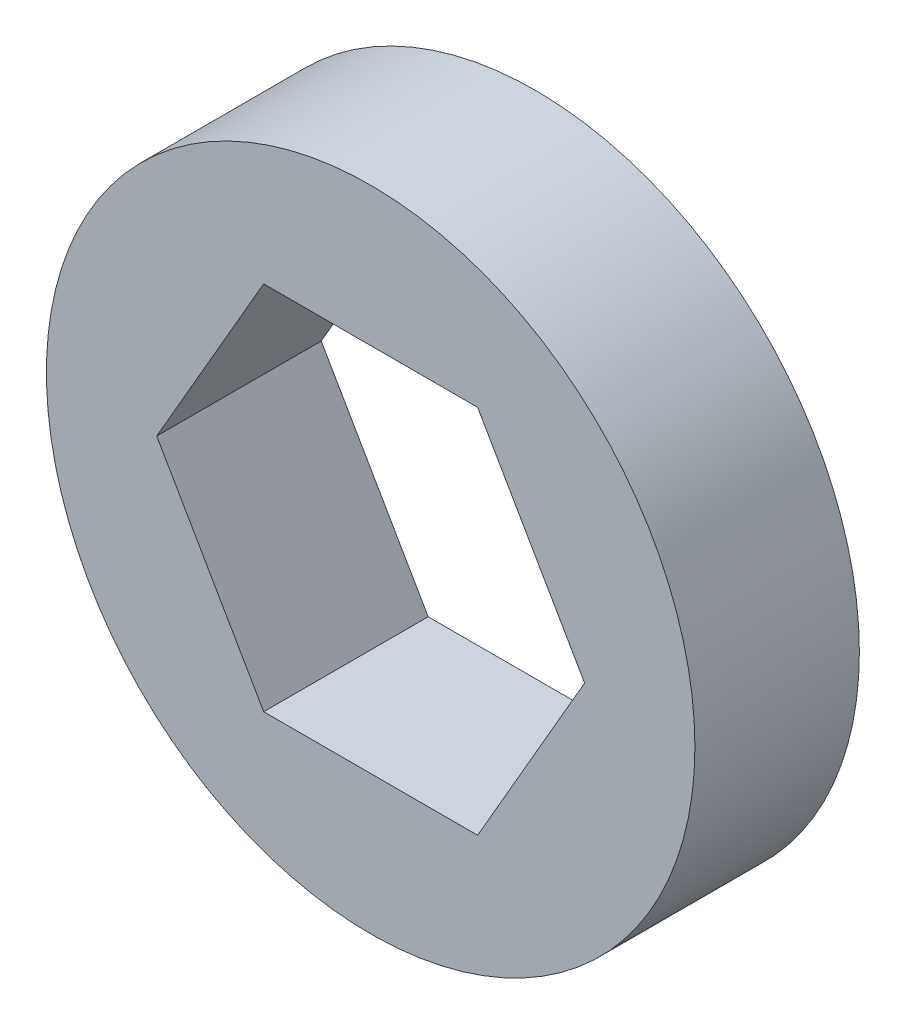
from build123d import *

# Parameters (mm, degrees)
SKETCH1_R           = 11.1125
BOSS_EXTRUDE1_DEPTH = 5.63753
CUT_EXTRUDE1_DEPTH  = 0.4


with BuildPart() as part:
    # Sketch1 → Boss-Extrude1 (new body)
    with BuildSketch(Plane.XY):
        Circle(SKETCH1_R)
        Polygon((3.666174209, 6.35), (-3.666174209, 6.35), (-7.332348419, 0), (-3.666174209, -6.35), (3.666174209, -6.35), (7.332348419, 0), align=None, mode=Mode.SUBTRACT)
    extrude(amount=BOSS_EXTRUDE1_DEPTH)

    # Sketch2 → Cut-Extrude1 (cut)
    # profile 1 of 4: a face of its own
    with BuildSketch(Plane(origin=(0, 0, 0), x_dir=(-1, 0, 0), z_dir=(0, 0, -1))):
        with BuildLine():
            add(Edge.make_bspline(
                [(-2.473143607, 7.778113982), (-2.472994827, 7.803558155), (-2.472705821, 7.852983826), (-2.469490715, 7.925004003), (-2.464149757, 7.992568134), (-2.456830305, 8.055679453), (-2.447923079, 8.114354254), (-2.436032483, 8.168435733), (-2.422510247, 8.218174197), (-2.406838245, 8.263731841), (-2.389154498, 8.305722442), (-2.36990753, 8.344922444), (-2.348333498, 8.381272534), (-2.325665398, 8.415352889), (-2.300985637, 8.446605637), (-2.274996543, 8.47547213), (-2.246683763, 8.50128522), (-2.217009756, 8.524801222), (-2.18570586, 8.545415804), (-2.153664365, 8.56357351), (-2.120664727, 8.579085593), (-2.086616851, 8.591282326), (-2.051826763, 8.601356532), (-2.016172843, 8.608245804), (-1.979596225, 8.612580545), (-1.954907681, 8.612994959), (-1.942386896, 8.613205128)],
                knots=[0, 0, 0, 0, 1.646270934, 3.197905019, 4.663502075, 6.030701355, 7.308322542, 8.50163776, 9.611534131, 10.641858119, 11.616356847, 12.558055219, 13.465016945, 14.349605745, 15.204443733, 16.039544428, 16.859896111, 17.680448484, 18.487036065, 19.28249412, 20.06191084, 20.843045899, 21.620316918, 22.403196591, 23.190181807, 24, 24, 24, 24], degree=3))
            add(Edge.make_bspline(
                [(-1.942386896, 8.613205128), (-1.929761518, 8.612983869), (-1.904653614, 8.612543855), (-1.867533158, 8.608314781), (-1.831270267, 8.601297521), (-1.79601954, 8.591354793), (-1.761491421, 8.579019612), (-1.727955979, 8.563558669), (-1.69520491, 8.545561469), (-1.663758672, 8.52441421), (-1.633272043, 8.500836535), (-1.60449386, 8.474183467), (-1.577421503, 8.44472413), (-1.551715204, 8.412773713), (-1.528104272, 8.377719407), (-1.50561918, 8.3401709), (-1.485493292, 8.299471543), (-1.466110064, 8.256300403), (-1.449379181, 8.209462957), (-1.434290563, 8.159223227), (-1.422099031, 8.104987792), (-1.411943896, 8.047041209), (-1.404076747, 7.985170672), (-1.398346942, 7.919508808), (-1.395320221, 7.850012416), (-1.394750217, 7.802497249), (-1.394457709, 7.778113982)],
                knots=[0, 0, 0, 0, 0.810914788, 1.612654377, 2.396697861, 3.181598691, 3.963628158, 4.749916497, 5.551656086, 6.361998678, 7.18212741, 8.025565596, 8.878627764, 9.750805457, 10.657531673, 11.591944965, 12.560506719, 13.57287815, 14.630710178, 15.753379473, 16.941251878, 18.199788006, 19.531962791, 20.947069417, 22.433333509, 24, 24, 24, 24], degree=3))
            add(Edge.make_bspline(
                [(-1.394457709, 7.778113982), (-1.39475325, 7.753837067), (-1.395329097, 7.706534487), (-1.398313011, 7.637350795), (-1.404190676, 7.572037397), (-1.411543063, 7.510437651), (-1.421726179, 7.452807946), (-1.434247093, 7.398948857), (-1.448149204, 7.348627795), (-1.465309986, 7.302257006), (-1.484092701, 7.259189617), (-1.50452845, 7.218972732), (-1.526422264, 7.181250878), (-1.550275017, 7.146325993), (-1.575699243, 7.113950673), (-1.603239097, 7.084696394), (-1.632118256, 7.057858268), (-1.662694601, 7.033976994), (-1.694631269, 7.013074244), (-1.727269851, 6.994380819), (-1.761189457, 6.979307418), (-1.795621403, 6.966364738), (-1.831058198, 6.956476676), (-1.867455668, 6.949639606), (-1.904628675, 6.944844518), (-1.929757242, 6.944478722), (-1.942386896, 6.944294872)],
                knots=[0, 0, 0, 0, 1.561518951, 3.042555995, 4.452378317, 5.7783523, 7.031515105, 8.214008947, 9.334062868, 10.386615937, 11.391082383, 12.354592575, 13.286541444, 14.194233754, 15.072674879, 15.931287219, 16.775624067, 17.606195743, 18.42308326, 19.229000347, 20.022332153, 20.807536673, 21.593273796, 22.3848459, 23.188221202, 24, 24, 24, 24], degree=3))
            add(Edge.make_bspline(
                [(-1.942386896, 6.944294872), (-1.954907334, 6.944506397), (-1.979595192, 6.944923484), (-2.016176828, 6.949238641), (-2.051683508, 6.956176244), (-2.086290443, 6.965890204), (-2.120175183, 6.977780505), (-2.152875999, 6.99327164), (-2.184756484, 7.01111245), (-2.215731583, 7.031430373), (-2.245219242, 7.054708422), (-2.273385395, 7.080455082), (-2.299522457, 7.109312843), (-2.32384935, 7.140826044), (-2.34696974, 7.174704765), (-2.36823742, 7.211411562), (-2.387909201, 7.250800889), (-2.405890355, 7.293127227), (-2.421832785, 7.339008213), (-2.435915138, 7.388968733), (-2.44703406, 7.443449753), (-2.456551329, 7.502013702), (-2.464227745, 7.564912235), (-2.469468457, 7.632179499), (-2.472707554, 7.703773575), (-2.472995603, 7.752881652), (-2.473143607, 7.778113982)],
                knots=[0, 0, 0, 0, 0.810891512, 1.598919785, 2.382837074, 3.152667961, 3.926044502, 4.706494248, 5.493654104, 6.291793342, 7.103789334, 7.925228297, 8.761435821, 9.622817696, 10.50288917, 11.416980706, 12.369136599, 13.353924996, 14.394355917, 15.514179734, 16.714354668, 17.994756427, 19.357759367, 20.818452758, 22.365282078, 24, 24, 24, 24], degree=3))
        make_face()
        with BuildLine():
            add(Edge.make_bspline(
                [(-2.330675658, 7.77875), (-2.33062148, 7.757546126), (-2.330516332, 7.71639357), (-2.327769412, 7.656593234), (-2.324027343, 7.600817406), (-2.319200755, 7.548995266), (-2.312032989, 7.501302225), (-2.304001696, 7.457410261), (-2.294228098, 7.417551657), (-2.282664286, 7.3814529), (-2.269492981, 7.348501359), (-2.255112108, 7.317839379), (-2.239663137, 7.289104751), (-2.222373379, 7.262555578), (-2.203543333, 7.238105282), (-2.183598319, 7.215321105), (-2.161793968, 7.195002474), (-2.13162977, 7.170633508), (-2.091807798, 7.145451615), (-2.04163352, 7.12352321), (-1.990076759, 7.109742596), (-1.955083156, 7.107990106), (-1.937616764, 7.107115385)],
                knots=[0, 0, 0, 0, 1.459021318, 2.831673884, 4.118529203, 5.306027144, 6.411944654, 7.436330062, 8.375795394, 9.233974572, 10.042671642, 10.816086306, 11.563610507, 12.285937304, 12.993564865, 13.685989202, 14.367179055, 15.041617293, 16.353048772, 17.594441528, 18.799311195, 20, 20, 20, 20], degree=3))
            add(Edge.make_bspline(
                [(-1.937616764, 7.107115385), (-1.920037391, 7.107840092), (-1.884914941, 7.109288012), (-1.833600684, 7.123257439), (-1.783784812, 7.144334694), (-1.744745039, 7.169257313), (-1.715044028, 7.192991948), (-1.693763822, 7.213227878), (-1.674232107, 7.235886432), (-1.655707309, 7.260333612), (-1.638716942, 7.287036489), (-1.623266876, 7.315866657), (-1.609168358, 7.346904177), (-1.601136041, 7.368571166), (-1.597029324, 7.379648938)],
                knots=[0, 0, 0, 0, 1.353760809, 2.704726607, 4.075137775, 5.516104923, 6.260822281, 7.007110065, 7.778089737, 8.566572457, 9.372053459, 10.217411131, 11.088608312, 12, 12, 12, 12], degree=3))
            add(Edge.make_bspline(
                [(-1.597029324, 7.379648938), (-1.592243344, 7.393813856), (-1.582525751, 7.422574713), (-1.570001839, 7.467189655), (-1.560138747, 7.51399948), (-1.551265363, 7.562724444), (-1.545208799, 7.61372388), (-1.540333898, 7.66683999), (-1.537462479, 7.722112822), (-1.537106538, 7.759666264), (-1.536925658, 7.77875)],
                knots=[0, 0, 0, 0, 0.884706709, 1.796334032, 2.740027952, 3.714592787, 4.726048262, 5.777819803, 6.87074269, 8, 8, 8, 8], degree=3))
            add(Edge.make_bspline(
                [(-1.536925658, 7.77875), (-1.537175208, 7.797830649), (-1.537663382, 7.835156477), (-1.539529369, 7.889820081), (-1.544347919, 7.941739386), (-1.549699662, 7.991138065), (-1.557590544, 8.037742667), (-1.56609855, 8.081943341), (-1.5775291, 8.123192499), (-1.58973914, 8.162135952), (-1.603713855, 8.198331249), (-1.619097063, 8.231947145), (-1.635526218, 8.26314593), (-1.653370735, 8.291842007), (-1.672418777, 8.318163911), (-1.693173093, 8.341583888), (-1.714810434, 8.362827798), (-1.7451168, 8.387076892), (-1.784792639, 8.41180184), (-1.834161915, 8.434555595), (-1.885538243, 8.447622213), (-1.920269774, 8.449464479), (-1.937616764, 8.450384615)],
                knots=[0, 0, 0, 0, 1.31362396, 2.569729283, 3.763502607, 4.902122613, 5.988968491, 7.01645872, 7.998833611, 8.933434873, 9.825090667, 10.667526885, 11.477055099, 12.250526234, 12.991942729, 13.710640831, 14.402115721, 15.076753259, 16.378508321, 17.609869233, 18.806226677, 20, 20, 20, 20], degree=3))
            add(Edge.make_bspline(
                [(-1.937616764, 8.450384615), (-1.955174782, 8.449463209), (-1.990322806, 8.447618718), (-2.042233128, 8.434604278), (-2.091991888, 8.411919826), (-2.131562809, 8.386995), (-2.161890312, 8.363255837), (-2.183245676, 8.342669838), (-2.203269119, 8.320151716), (-2.221714825, 8.295476562), (-2.238991036, 8.268958341), (-2.254857424, 8.240388437), (-2.269152784, 8.209622069), (-2.282344699, 8.176685328), (-2.293943785, 8.140589686), (-2.303511404, 8.100780178), (-2.312350174, 8.05702782), (-2.318607314, 8.009076471), (-2.324169803, 7.957241352), (-2.327744558, 7.901326283), (-2.330525521, 7.841425653), (-2.33062461, 7.80006032), (-2.330675658, 7.77875)],
                knots=[0, 0, 0, 0, 1.207732386, 2.417664972, 3.655092373, 4.956220595, 5.625982001, 6.301752483, 6.994047911, 7.697131622, 8.419323945, 9.170223765, 9.943494443, 10.752040957, 11.610060368, 12.549350801, 13.567764191, 14.679664412, 15.874934091, 17.154273443, 18.533957287, 20, 20, 20, 20], degree=3))
        make_face(mode=Mode.SUBTRACT)
    # profile 2 of 4: a face of its own
    with BuildSketch(Plane(origin=(0, 0, 0), x_dir=(-1, 0, 0), z_dir=(0, 0, -1))):
        with BuildLine():
            add(Edge.make_bspline(
                [(-1.251989761, 7.778113982), (-1.251840981, 7.803558155), (-1.251551974, 7.852983826), (-1.248336869, 7.925004003), (-1.24299591, 7.992568134), (-1.235676459, 8.055679453), (-1.226769232, 8.114354254), (-1.214878637, 8.168435733), (-1.201356401, 8.218174197), (-1.185684399, 8.263731841), (-1.168000652, 8.305722442), (-1.148753684, 8.344922444), (-1.127179652, 8.381272534), (-1.104511552, 8.415352889), (-1.079831791, 8.446605637), (-1.053842697, 8.47547213), (-1.025529917, 8.50128522), (-0.99585591, 8.524801222), (-0.964552013, 8.545415804), (-0.932510518, 8.56357351), (-0.899510881, 8.579085593), (-0.865463005, 8.591282326), (-0.830672917, 8.601356532), (-0.795018997, 8.608245804), (-0.758442378, 8.612580545), (-0.733753835, 8.612994959), (-0.72123305, 8.613205128)],
                knots=[0, 0, 0, 0, 1.646270934, 3.197905019, 4.663502075, 6.030701355, 7.308322542, 8.50163776, 9.611534131, 10.641858119, 11.616356847, 12.558055219, 13.465016945, 14.349605745, 15.204443733, 16.039544428, 16.859896111, 17.680448484, 18.487036065, 19.28249412, 20.06191084, 20.843045899, 21.620316918, 22.403196591, 23.190181807, 24, 24, 24, 24], degree=3))
            add(Edge.make_bspline(
                [(-0.72123305, 8.613205128), (-0.708607672, 8.612983869), (-0.683499768, 8.612543855), (-0.646379312, 8.608314781), (-0.610116421, 8.601297521), (-0.574865694, 8.591354793), (-0.540337575, 8.579019612), (-0.506802133, 8.563558669), (-0.474051064, 8.545561469), (-0.442604826, 8.52441421), (-0.412118197, 8.500836535), (-0.383340014, 8.474183467), (-0.356267657, 8.44472413), (-0.330561358, 8.412773713), (-0.306950426, 8.377719407), (-0.284465334, 8.3401709), (-0.264339446, 8.299471543), (-0.244956218, 8.256300403), (-0.228225335, 8.209462957), (-0.213136717, 8.159223227), (-0.200945184, 8.104987792), (-0.19079005, 8.047041209), (-0.182922901, 7.985170672), (-0.177193095, 7.919508808), (-0.174166375, 7.850012416), (-0.173596371, 7.802497249), (-0.173303863, 7.778113982)],
                knots=[0, 0, 0, 0, 0.810914788, 1.612654377, 2.396697861, 3.181598691, 3.963628158, 4.749916497, 5.551656086, 6.361998678, 7.18212741, 8.025565596, 8.878627764, 9.750805457, 10.657531673, 11.591944965, 12.560506719, 13.57287815, 14.630710178, 15.753379473, 16.941251878, 18.199788006, 19.531962791, 20.947069417, 22.433333509, 24, 24, 24, 24], degree=3))
            add(Edge.make_bspline(
                [(-0.173303863, 7.778113982), (-0.173599403, 7.753837067), (-0.174175251, 7.706534487), (-0.177159165, 7.637350795), (-0.18303683, 7.572037397), (-0.190389217, 7.510437651), (-0.200572333, 7.452807946), (-0.213093247, 7.398948857), (-0.226995358, 7.348627795), (-0.24415614, 7.302257006), (-0.262938855, 7.259189617), (-0.283374604, 7.218972732), (-0.305268418, 7.181250878), (-0.32912117, 7.146325993), (-0.354545397, 7.113950673), (-0.382085251, 7.084696394), (-0.41096441, 7.057858268), (-0.441540755, 7.033976994), (-0.473477423, 7.013074244), (-0.506116005, 6.994380819), (-0.540035611, 6.979307418), (-0.574467557, 6.966364738), (-0.609904352, 6.956476676), (-0.646301822, 6.949639606), (-0.683474829, 6.944844518), (-0.708603396, 6.944478722), (-0.72123305, 6.944294872)],
                knots=[0, 0, 0, 0, 1.561518951, 3.042555995, 4.452378317, 5.7783523, 7.031515105, 8.214008947, 9.334062868, 10.386615937, 11.391082383, 12.354592575, 13.286541444, 14.194233754, 15.072674879, 15.931287219, 16.775624067, 17.606195743, 18.42308326, 19.229000347, 20.022332153, 20.807536673, 21.593273796, 22.3848459, 23.188221202, 24, 24, 24, 24], degree=3))
            add(Edge.make_bspline(
                [(-0.72123305, 6.944294872), (-0.733753487, 6.944506397), (-0.758441346, 6.944923484), (-0.795022982, 6.949238641), (-0.830529662, 6.956176244), (-0.865136597, 6.965890204), (-0.899021337, 6.977780505), (-0.931722153, 6.99327164), (-0.963602638, 7.01111245), (-0.994577737, 7.031430373), (-1.024065396, 7.054708422), (-1.052231549, 7.080455082), (-1.078368611, 7.109312843), (-1.102695504, 7.140826044), (-1.125815894, 7.174704765), (-1.147083574, 7.211411562), (-1.166755355, 7.250800889), (-1.184736509, 7.293127227), (-1.200678939, 7.339008213), (-1.214761292, 7.388968733), (-1.225880213, 7.443449753), (-1.235397483, 7.502013702), (-1.243073899, 7.564912235), (-1.248314611, 7.632179499), (-1.251553707, 7.703773575), (-1.251841757, 7.752881652), (-1.251989761, 7.778113982)],
                knots=[0, 0, 0, 0, 0.810891512, 1.598919785, 2.382837074, 3.152667961, 3.926044502, 4.706494248, 5.493654104, 6.291793342, 7.103789334, 7.925228297, 8.761435821, 9.622817696, 10.50288917, 11.416980706, 12.369136599, 13.353924996, 14.394355917, 15.514179734, 16.714354668, 17.994756427, 19.357759367, 20.818452758, 22.365282078, 24, 24, 24, 24], degree=3))
        make_face()
        with BuildLine():
            add(Edge.make_bspline(
                [(-1.109521812, 7.77875), (-1.109467634, 7.757546126), (-1.109362486, 7.71639357), (-1.106615566, 7.656593234), (-1.102873497, 7.600817406), (-1.098046908, 7.548995266), (-1.090879142, 7.501302225), (-1.082847849, 7.457410261), (-1.073074252, 7.417551657), (-1.06151044, 7.3814529), (-1.048339135, 7.348501359), (-1.033958261, 7.317839379), (-1.018509291, 7.289104751), (-1.001219533, 7.262555578), (-0.982389487, 7.238105282), (-0.962444473, 7.215321105), (-0.940640122, 7.195002474), (-0.910475924, 7.170633508), (-0.870653952, 7.145451615), (-0.820479674, 7.12352321), (-0.768922912, 7.109742596), (-0.73392931, 7.107990106), (-0.716462918, 7.107115385)],
                knots=[0, 0, 0, 0, 1.459021318, 2.831673884, 4.118529203, 5.306027144, 6.411944654, 7.436330062, 8.375795394, 9.233974572, 10.042671642, 10.816086306, 11.563610507, 12.285937304, 12.993564865, 13.685989202, 14.367179055, 15.041617293, 16.353048772, 17.594441528, 18.799311195, 20, 20, 20, 20], degree=3))
            add(Edge.make_bspline(
                [(-0.716462918, 7.107115385), (-0.698883545, 7.107840092), (-0.663761095, 7.109288012), (-0.612446838, 7.123257439), (-0.562630966, 7.144334694), (-0.523591193, 7.169257313), (-0.493890182, 7.192991948), (-0.472609976, 7.213227878), (-0.453078261, 7.235886432), (-0.434553463, 7.260333612), (-0.417563096, 7.287036489), (-0.40211303, 7.315866657), (-0.388014512, 7.346904177), (-0.379982194, 7.368571166), (-0.375875478, 7.379648938)],
                knots=[0, 0, 0, 0, 1.353760809, 2.704726607, 4.075137775, 5.516104923, 6.260822281, 7.007110065, 7.778089737, 8.566572457, 9.372053459, 10.217411131, 11.088608312, 12, 12, 12, 12], degree=3))
            add(Edge.make_bspline(
                [(-0.375875478, 7.379648938), (-0.371089497, 7.393813856), (-0.361371905, 7.422574713), (-0.348847993, 7.467189655), (-0.338984901, 7.51399948), (-0.330111517, 7.562724444), (-0.324054953, 7.61372388), (-0.319180052, 7.66683999), (-0.316308633, 7.722112822), (-0.315952692, 7.759666264), (-0.315771812, 7.77875)],
                knots=[0, 0, 0, 0, 0.884706709, 1.796334032, 2.740027952, 3.714592787, 4.726048262, 5.777819803, 6.87074269, 8, 8, 8, 8], degree=3))
            add(Edge.make_bspline(
                [(-0.315771812, 7.77875), (-0.316021362, 7.797830649), (-0.316509535, 7.835156477), (-0.318375523, 7.889820081), (-0.323194073, 7.941739386), (-0.328545816, 7.991138065), (-0.336436698, 8.037742667), (-0.344944704, 8.081943341), (-0.356375253, 8.123192499), (-0.368585294, 8.162135952), (-0.382560009, 8.198331249), (-0.397943217, 8.231947145), (-0.414372372, 8.26314593), (-0.432216888, 8.291842007), (-0.45126493, 8.318163911), (-0.472019247, 8.341583888), (-0.493656588, 8.362827798), (-0.523962954, 8.387076892), (-0.563638793, 8.41180184), (-0.613008069, 8.434555595), (-0.664384397, 8.447622213), (-0.699115928, 8.449464479), (-0.716462918, 8.450384615)],
                knots=[0, 0, 0, 0, 1.31362396, 2.569729283, 3.763502607, 4.902122613, 5.988968491, 7.01645872, 7.998833611, 8.933434873, 9.825090667, 10.667526885, 11.477055099, 12.250526234, 12.991942729, 13.710640831, 14.402115721, 15.076753259, 16.378508321, 17.609869233, 18.806226677, 20, 20, 20, 20], degree=3))
            add(Edge.make_bspline(
                [(-0.716462918, 8.450384615), (-0.734020936, 8.449463209), (-0.76916896, 8.447618718), (-0.821079282, 8.434604278), (-0.870838042, 8.411919826), (-0.910408962, 8.386995), (-0.940736466, 8.363255837), (-0.96209183, 8.342669838), (-0.982115272, 8.320151716), (-1.000560979, 8.295476562), (-1.01783719, 8.268958341), (-1.033703578, 8.240388437), (-1.047998938, 8.209622069), (-1.061190853, 8.176685328), (-1.072789939, 8.140589686), (-1.082357558, 8.100780178), (-1.091196328, 8.05702782), (-1.097453468, 8.009076471), (-1.103015957, 7.957241352), (-1.106590711, 7.901326283), (-1.109371675, 7.841425653), (-1.109470764, 7.80006032), (-1.109521812, 7.77875)],
                knots=[0, 0, 0, 0, 1.207732386, 2.417664972, 3.655092373, 4.956220595, 5.625982001, 6.301752483, 6.994047911, 7.697131622, 8.419323945, 9.170223765, 9.943494443, 10.752040957, 11.610060368, 12.549350801, 13.567764191, 14.679664412, 15.874934091, 17.154273443, 18.533957287, 20, 20, 20, 20], degree=3))
        make_face(mode=Mode.SUBTRACT)
    # profile 3 of 4: a face of its own
    with BuildSketch(Plane(origin=(0, 0, 0), x_dir=(-1, 0, 0), z_dir=(0, 0, -1))):
        Polygon((0.835738104, 8.613205128), (0.864676906, 8.613205128), (0.864676906, 7.514166667), (1.047849983, 7.514166667), (1.047849983, 7.351346154), (0.864676906, 7.351346154), (0.864676906, 6.985), (0.722208957, 6.985), (0.722208957, 7.351346154), (-0.030835915, 7.351346154), align=None)
        Polygon((0.722208957, 7.514166667), (0.722208957, 8.203609776), (0.249011842, 7.514166667), align=None, mode=Mode.SUBTRACT)
    # profile 4 of 4: a face of its own
    with BuildSketch(Plane(origin=(0, 0, 0), x_dir=(-1, 0, 0), z_dir=(0, 0, -1))):
        with BuildLine():
            add(Edge.make_bspline(
                [(1.962125323, 7.869382512), (1.975119486, 7.862607082), (2.000462442, 7.849392731), (2.03655639, 7.82811532), (2.069542373, 7.80569031), (2.100335592, 7.783176903), (2.12839504, 7.759712904), (2.153406971, 7.735205008), (2.175989213, 7.710264954), (2.195686361, 7.68447042), (2.213011355, 7.657889932), (2.227984716, 7.630453726), (2.240783233, 7.602221928), (2.250926423, 7.572886366), (2.259282022, 7.542877962), (2.265031314, 7.511809234), (2.268123273, 7.479884908), (2.268707842, 7.458309286), (2.269003829, 7.447384816)],
                knots=[0, 0, 0, 0, 1.272397273, 2.481599622, 3.635517121, 4.734568067, 5.792894095, 6.808321871, 7.773003508, 8.711915296, 9.623354172, 10.525449501, 11.423591555, 12.311487226, 13.218079475, 14.126165749, 15.051214107, 16, 16, 16, 16], degree=3))
            add(Edge.make_bspline(
                [(2.269003829, 7.447384816), (2.268653935, 7.432100487), (2.267961363, 7.401847066), (2.26192887, 7.357194722), (2.252896912, 7.31382795), (2.239707276, 7.271756256), (2.222601559, 7.23121179), (2.201520994, 7.192159846), (2.177658055, 7.153960374), (2.158493646, 7.130456574), (2.148796497, 7.118563702)],
                knots=[0, 0, 0, 0, 1.025265484, 2.029385089, 3.018602448, 3.995076438, 4.983346944, 5.966715145, 6.97116228, 8, 8, 8, 8], degree=3))
            add(Edge.make_bspline(
                [(2.148796497, 7.118563702), (2.136170668, 7.10468724), (2.11107503, 7.077105792), (2.068084202, 7.04129596), (2.020902848, 7.01120177), (1.969713532, 6.986676304), (1.91465309, 6.967587361), (1.855733252, 6.953870219), (1.792839154, 6.94601326), (1.749611316, 6.944877522), (1.727434819, 6.944294872)],
                knots=[0, 0, 0, 0, 0.954267603, 1.896743057, 2.838368354, 3.796610408, 4.779680527, 5.799409237, 6.871065594, 8, 8, 8, 8], degree=3))
            add(Edge.make_bspline(
                [(1.727434819, 6.944294872), (1.706110889, 6.944817603), (1.664616687, 6.945834784), (1.604220078, 6.952726544), (1.5479214, 6.964804184), (1.495393308, 6.981334418), (1.446952472, 7.002838343), (1.402736922, 7.029602871), (1.362108728, 7.060550703), (1.326300863, 7.09657066), (1.294510747, 7.135150481), (1.266585237, 7.174952104), (1.243374138, 7.215979163), (1.223722205, 7.257619908), (1.208678138, 7.300457985), (1.198258599, 7.344272991), (1.191641303, 7.388988395), (1.19076086, 7.419165252), (1.190317932, 7.434346454)],
                knots=[0, 0, 0, 0, 1.256902934, 2.445805442, 3.576955095, 4.645999104, 5.686449165, 6.692658513, 7.68621702, 8.689161843, 9.678783111, 10.630372946, 11.551080876, 12.453998257, 13.34127905, 14.221779781, 15.105423033, 16, 16, 16, 16], degree=3))
            add(Edge.make_bspline(
                [(1.190317932, 7.434346454), (1.190580042, 7.445485802), (1.191098064, 7.467501085), (1.194683478, 7.500026388), (1.200447673, 7.53168392), (1.208276069, 7.562590615), (1.21888557, 7.592521463), (1.231695395, 7.621618285), (1.246632388, 7.64991393), (1.263904916, 7.677563137), (1.283999049, 7.704178487), (1.306751847, 7.73021167), (1.332618059, 7.755258732), (1.361309925, 7.779625689), (1.392499556, 7.803744791), (1.426997079, 7.826312568), (1.463887979, 7.848926716), (1.490106859, 7.862446921), (1.503556613, 7.869382512)],
                knots=[0, 0, 0, 0, 0.941657376, 1.861047343, 2.762797495, 3.66048619, 4.553285746, 5.444104102, 6.34607688, 7.256116206, 8.197091036, 9.162375105, 10.176350973, 11.237807142, 12.343728897, 13.50695164, 14.721116704, 16, 16, 16, 16], degree=3))
            add(Edge.make_bspline(
                [(1.503556613, 7.869382512), (1.485145526, 7.879422211), (1.449496506, 7.898861877), (1.402293581, 7.934579179), (1.361748549, 7.973263295), (1.328975873, 8.015731094), (1.303180255, 8.060655927), (1.285482531, 8.107756713), (1.27350984, 8.156160093), (1.272323829, 8.18922826), (1.271728188, 8.205835837)],
                knots=[0, 0, 0, 0, 1.166880483, 2.259407225, 3.286803203, 4.280235371, 5.237608625, 6.161067461, 7.076446754, 8, 8, 8, 8], degree=3))
            add(Edge.make_bspline(
                [(1.271728188, 8.205835837), (1.27246997, 8.222752944), (1.27396108, 8.256759279), (1.286018515, 8.307380628), (1.305667259, 8.35709957), (1.33239214, 8.405675125), (1.365678485, 8.451463259), (1.405613882, 8.492530045), (1.451244663, 8.528503467), (1.502343053, 8.558700517), (1.557332345, 8.583276677), (1.615351263, 8.600230461), (1.675388922, 8.611313986), (1.716254674, 8.612568861), (1.736975083, 8.613205128)],
                knots=[0, 0, 0, 0, 0.888701115, 1.786444228, 2.72001202, 3.692817113, 4.693886446, 5.687152267, 6.695133018, 7.739871481, 8.800368666, 9.853104506, 10.91144658, 12, 12, 12, 12], degree=3))
            add(Edge.make_bspline(
                [(1.736975083, 8.613205128), (1.757160742, 8.612549108), (1.796964562, 8.611255512), (1.855472839, 8.600466464), (1.911454837, 8.582446288), (1.964717503, 8.558000048), (2.014307314, 8.527888828), (2.058123362, 8.491421289), (2.096827783, 8.450535657), (2.128842847, 8.404761408), (2.155223872, 8.356372506), (2.173593924, 8.30574372), (2.185364998, 8.253968968), (2.186849702, 8.218936017), (2.187593573, 8.201383714)],
                knots=[0, 0, 0, 0, 1.072916533, 2.115669174, 3.151510826, 4.193348718, 5.225979165, 6.227137561, 7.216255879, 8.211077061, 9.189680878, 10.138522389, 11.067357538, 12, 12, 12, 12], degree=3))
            add(Edge.make_bspline(
                [(2.187593573, 8.201383714), (2.186942897, 8.184158584), (2.185665007, 8.150329409), (2.174915391, 8.101014165), (2.156811853, 8.054830598), (2.132094857, 8.011254652), (2.099879725, 7.971076615), (2.060596479, 7.933785573), (2.014558308, 7.899075191), (1.979968549, 7.87948709), (1.962125323, 7.869382512)],
                knots=[0, 0, 0, 0, 0.975232327, 1.915300861, 2.843280834, 3.77672583, 4.742871857, 5.749627742, 6.839139064, 8, 8, 8, 8], degree=3))
        make_face()
        with BuildLine():
            add(Edge.make_bspline(
                [(1.729024863, 8.450384615), (1.717889319, 8.450089141), (1.696103325, 8.449511063), (1.664158892, 8.446490895), (1.63378214, 8.440615686), (1.604655688, 8.432796699), (1.577178869, 8.422233933), (1.550978518, 8.40980834), (1.526500542, 8.39470166), (1.503449451, 8.377755688), (1.482698207, 8.35911712), (1.464281143, 8.33969804), (1.448983034, 8.319117059), (1.435992245, 8.297886124), (1.426566342, 8.275375113), (1.419506819, 8.252274186), (1.414734616, 8.228291423), (1.414377025, 8.211900934), (1.414196137, 8.203609776)],
                knots=[0, 0, 0, 0, 1.203892937, 2.355340988, 3.463153438, 4.544400666, 5.610487187, 6.640501085, 7.674077295, 8.714426146, 9.728707835, 10.68524104, 11.601827946, 12.495867327, 13.368432065, 14.231010473, 15.105153427, 16, 16, 16, 16], degree=3))
            add(Edge.make_bspline(
                [(1.414196137, 8.203609776), (1.414507907, 8.195318259), (1.415124009, 8.17893303), (1.419888835, 8.15473687), (1.426990337, 8.130959913), (1.438171173, 8.108167536), (1.451581628, 8.085569083), (1.468133119, 8.063729353), (1.487858499, 8.042572339), (1.510095946, 8.022277993), (1.534321893, 8.003273911), (1.559986798, 7.986776075), (1.586768555, 7.972972032), (1.614391993, 7.961483338), (1.643138646, 7.952552545), (1.672832368, 7.946216766), (1.703478149, 7.94227886), (1.724242913, 7.941808497), (1.734749021, 7.941570513)],
                knots=[0, 0, 0, 0, 0.873023192, 1.725219244, 2.590779336, 3.480155217, 4.391973325, 5.357036234, 6.360879153, 7.436073238, 8.526419356, 9.601555421, 10.645666583, 11.697338044, 12.750135903, 13.812665442, 14.89329948, 16, 16, 16, 16], degree=3))
            add(Edge.make_bspline(
                [(1.734749021, 7.941570513), (1.748242818, 7.94196642), (1.775097135, 7.942754325), (1.814684546, 7.950080036), (1.853175817, 7.961603435), (1.890159534, 7.977369562), (1.9246784, 7.997157913), (1.955448717, 8.020849318), (1.982208022, 8.047896733), (2.004678227, 8.077879091), (2.022099836, 8.109788561), (2.035662442, 8.141810837), (2.04358235, 8.174287563), (2.044615389, 8.196044007), (2.045125624, 8.206789864)],
                knots=[0, 0, 0, 0, 1.076279235, 2.141928126, 3.20205304, 4.278698113, 5.344010996, 6.36967002, 7.368914609, 8.37248503, 9.349703398, 10.264243087, 11.142681841, 12, 12, 12, 12], degree=3))
            add(Edge.make_bspline(
                [(2.045125624, 8.206789864), (2.04488437, 8.214331866), (2.044405517, 8.229301659), (2.04045942, 8.251407989), (2.033938953, 8.273011407), (2.025111056, 8.29429038), (2.013495184, 8.314946355), (1.999722857, 8.335304041), (1.982993101, 8.354905477), (1.964216861, 8.374207458), (1.942923765, 8.392070926), (1.919154848, 8.407780241), (1.893031968, 8.421120845), (1.864554509, 8.431956102), (1.833827347, 8.440094239), (1.800992007, 8.446188582), (1.765774704, 8.449623529), (1.741540496, 8.450125418), (1.729024863, 8.450384615)],
                knots=[0, 0, 0, 0, 0.814439003, 1.616544685, 2.417341072, 3.248991801, 4.09997495, 4.973547432, 5.9003056, 6.880240646, 7.880314356, 8.896779544, 9.951930927, 11.043077905, 12.18215768, 13.381699519, 14.647792085, 16, 16, 16, 16], degree=3))
        make_face(mode=Mode.SUBTRACT)
        with BuildLine():
            add(Edge.make_bspline(
                [(1.738247118, 7.77875), (1.724129351, 7.778498884), (1.696433737, 7.778006256), (1.65585863, 7.772522804), (1.616918088, 7.764889472), (1.579743402, 7.753309413), (1.544350272, 7.738252434), (1.510547099, 7.720139267), (1.478592479, 7.698728227), (1.448927671, 7.674291334), (1.421838875, 7.647957224), (1.398072503, 7.620079756), (1.377889699, 7.591177035), (1.361636761, 7.560881989), (1.348296439, 7.529836108), (1.339536216, 7.497266234), (1.333920226, 7.463798508), (1.333166104, 7.441047321), (1.33278588, 7.429576322)],
                knots=[0, 0, 0, 0, 1.140299081, 2.23698856, 3.303958914, 4.344563908, 5.37730929, 6.408454204, 7.439741482, 8.480804886, 9.510774543, 10.48932336, 11.43758569, 12.353841022, 13.263987381, 14.161954604, 15.073269652, 16, 16, 16, 16], degree=3))
            add(Edge.make_bspline(
                [(1.33278588, 7.429576322), (1.333404216, 7.415320161), (1.334630978, 7.387036271), (1.344363096, 7.345233735), (1.359982072, 7.304765614), (1.381764937, 7.265961692), (1.408737729, 7.229698608), (1.441905806, 7.198089771), (1.4792079, 7.170003957), (1.521906141, 7.147288858), (1.568546195, 7.129148335), (1.619115658, 7.116649737), (1.672888782, 7.108375937), (1.710017954, 7.10754219), (1.729024863, 7.107115385)],
                knots=[0, 0, 0, 0, 0.898778495, 1.783155532, 2.693654817, 3.627872908, 4.583023416, 5.533784346, 6.509005473, 7.520592997, 8.575161974, 9.658835044, 10.801527049, 12, 12, 12, 12], degree=3))
            add(Edge.make_bspline(
                [(1.729024863, 7.107115385), (1.743879494, 7.107400594), (1.772821079, 7.107956274), (1.815042206, 7.112861329), (1.854885983, 7.120639908), (1.892275145, 7.131953588), (1.927628244, 7.145764828), (1.960345872, 7.163532165), (1.991269704, 7.183739825), (2.018875931, 7.207714775), (2.044018851, 7.23333226), (2.065941452, 7.260451315), (2.084972198, 7.288334906), (2.099908739, 7.317613161), (2.111849575, 7.347724369), (2.120432759, 7.37894619), (2.125728757, 7.411374385), (2.126264377, 7.433372178), (2.12653588, 7.444522736)],
                knots=[0, 0, 0, 0, 1.224942928, 2.386581632, 3.501229538, 4.569074225, 5.605009692, 6.626002462, 7.634866581, 8.645888296, 9.63523824, 10.59253846, 11.518950513, 12.414518923, 13.29783783, 14.186679152, 15.080837789, 16, 16, 16, 16], degree=3))
            add(Edge.make_bspline(
                [(2.12653588, 7.444522736), (2.126125013, 7.455352816), (2.125314855, 7.476707841), (2.120172856, 7.508351944), (2.111139583, 7.538923935), (2.098744657, 7.568791616), (2.082243292, 7.597349811), (2.062810083, 7.625342503), (2.039363107, 7.651992748), (2.012868823, 7.677507545), (1.983994937, 7.701100397), (1.953303053, 7.721971232), (1.921029422, 7.739548084), (1.887242337, 7.753843066), (1.852016821, 7.765085954), (1.815378782, 7.772939995), (1.777285325, 7.777883743), (1.751406866, 7.778457986), (1.738247118, 7.77875)],
                knots=[0, 0, 0, 0, 0.917430815, 1.809013306, 2.70690318, 3.612392954, 4.541220862, 5.495268465, 6.494511384, 7.542276156, 8.608045339, 9.649016899, 10.681629292, 11.715607085, 12.752076957, 13.808767841, 14.885711793, 16, 16, 16, 16], degree=3))
        make_face(mode=Mode.SUBTRACT)
    extrude(amount=-CUT_EXTRUDE1_DEPTH, mode=Mode.SUBTRACT)


solid = part.part
